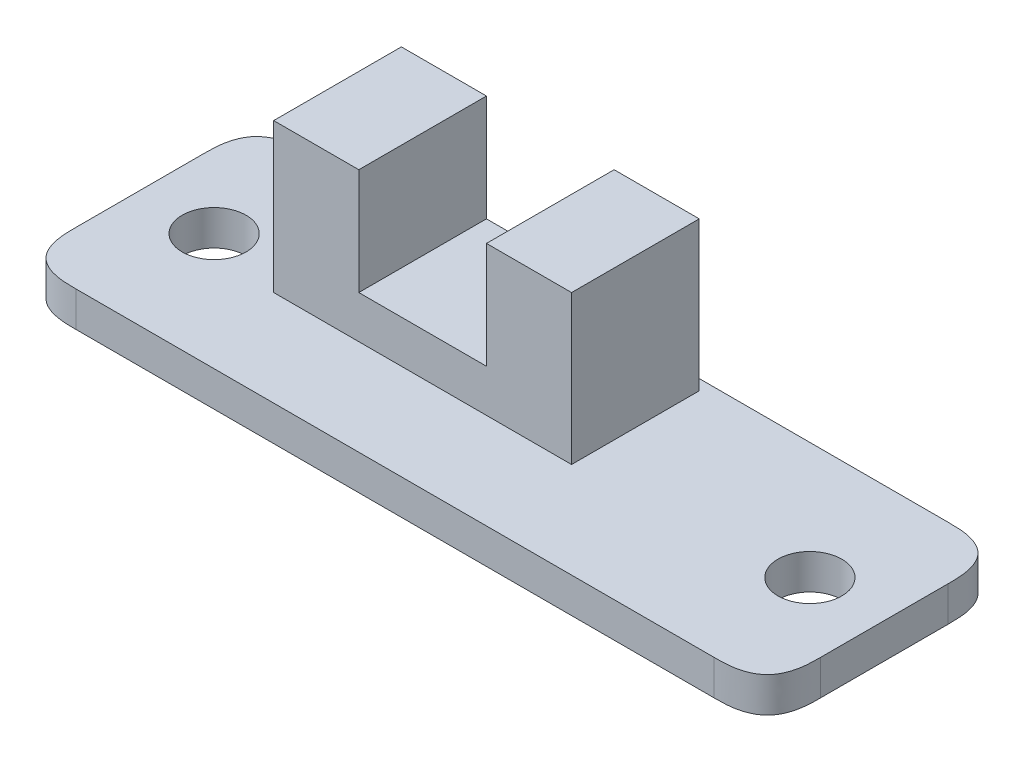
from build123d import *

# Parameters (mm, degrees)
SKETCH1_W           = 35
SKETCH1_H           = 11
SKETCH1_R           = 1.5
BOSS_EXTRUDE1_DEPTH = 1.65
FILLET1_SIZE        = 2.5
BOSS_EXTRUDE2_START = 1.65
SKETCH1_3_W         = 14
SKETCH1_3_H         = 6
BOSS_EXTRUDE2_DEPTH = 2
BOSS_EXTRUDE3_START = 3.65
SKETCH1_4_W         = 4
SKETCH1_4_H         = 5
SKETCH1_4_H_2       = 1
BOSS_EXTRUDE3_DEPTH = 5


with BuildPart() as part:
    # Sketch1 → Boss-Extrude1 (new body)
    with BuildSketch(Plane(origin=(0, 0, 0), x_dir=(1, 0, 0), z_dir=(0, 1, 0))):
        with Locations((17.5, 5.5)):
            Rectangle(SKETCH1_W, SKETCH1_H)
        with Locations(Location((3.5, 5.5, 0), (0, 0, 270))):
            Circle(SKETCH1_R, mode=Mode.SUBTRACT)
        with Locations(Location((31.5, 5.5, 0), (0, 0, 270))):
            Circle(SKETCH1_R, mode=Mode.SUBTRACT)
    extrude(amount=BOSS_EXTRUDE1_DEPTH)

    # Fillet1
    # a fillet whose section is not a circle: 2.5 mm, written as the material it takes off along each edge
    with BuildSketch(Plane(origin=(0, -6.25, -11), x_dir=(1, 0, 0), z_dir=(0, 1, 0)), Plane(origin=(35, -6.25, -11), x_dir=(0, 0, 1), z_dir=(0, 1, 0)), Plane(origin=(35, -6.25, 0), x_dir=(-1, 0, 0), z_dir=(0, 1, 0))) as fillet1_piece_1:
        with BuildLine():
            add(Edge.make_bspline([(FILLET1_SIZE, 0), (FILLET1_SIZE * 0.831801948466, 0), (FILLET1_SIZE * 0.663603896932, 0), (FILLET1_SIZE * 0.292893218813, -FILLET1_SIZE * 0.0716919198361), (FILLET1_SIZE * 0.0716919198361, -FILLET1_SIZE * 0.292893218813), (0, -FILLET1_SIZE * 0.663603896932), (0, -FILLET1_SIZE * 0.831801948466), (0, -FILLET1_SIZE)], knots=[0, 0, 0, 0, 0, 0, 0.5, 0.5, 1, 1, 1, 1, 1, 1], degree=5))
            Line((0, -FILLET1_SIZE), (0, 0))
            Line((0, 0), (FILLET1_SIZE, 0))
        make_face()
    extrude(amount=14.15, mode=Mode.SUBTRACT)
    with BuildSketch(Plane(origin=(0, -6.25, 0), x_dir=(1, 0, 0), z_dir=(0, 1, 0))) as fillet1_piece_2:
        with BuildLine():
            add(Edge.make_bspline([(FILLET1_SIZE, 0), (FILLET1_SIZE * 0.831801948466, 0), (FILLET1_SIZE * 0.663603896932, 0), (FILLET1_SIZE * 0.292893218813, FILLET1_SIZE * 0.0716919198361), (FILLET1_SIZE * 0.0716919198361, FILLET1_SIZE * 0.292893218813), (0, FILLET1_SIZE * 0.663603896932), (0, FILLET1_SIZE * 0.831801948466), (0, FILLET1_SIZE)], knots=[0, 0, 0, 0, 0, 0, 0.5, 0.5, 1, 1, 1, 1, 1, 1], degree=5))
            Line((0, FILLET1_SIZE), (0, 0))
            Line((0, 0), (FILLET1_SIZE, 0))
        make_face()
    extrude(amount=14.15, mode=Mode.SUBTRACT)

    # Sketch1<3> → Boss-Extrude2 (add)
    with BuildSketch(Plane(origin=(0, 0, 0), x_dir=(1, 0, 0), z_dir=(0, 1, 0)).offset(BOSS_EXTRUDE2_START)):
        with Locations((14.3, 7.5)):
            Rectangle(SKETCH1_3_W, SKETCH1_3_H)
    extrude(amount=BOSS_EXTRUDE2_DEPTH)

    # Sketch1<4> → Boss-Extrude3 (add)
    with BuildSketch(Plane(origin=(0, 0, 0), x_dir=(1, 0, 0), z_dir=(0, 1, 0)).offset(BOSS_EXTRUDE3_START)):
        with Locations((9.3, 8)):
            Rectangle(SKETCH1_4_W, SKETCH1_4_H)
        with Locations((19.3, 8)):
            Rectangle(SKETCH1_4_W, SKETCH1_4_H)
        with Locations((9.3, 5)):
            Rectangle(SKETCH1_4_W, SKETCH1_4_H_2)
        with Locations((19.3, 5)):
            Rectangle(SKETCH1_4_W, SKETCH1_4_H_2)
    extrude(amount=BOSS_EXTRUDE3_DEPTH)


solid = part.part
